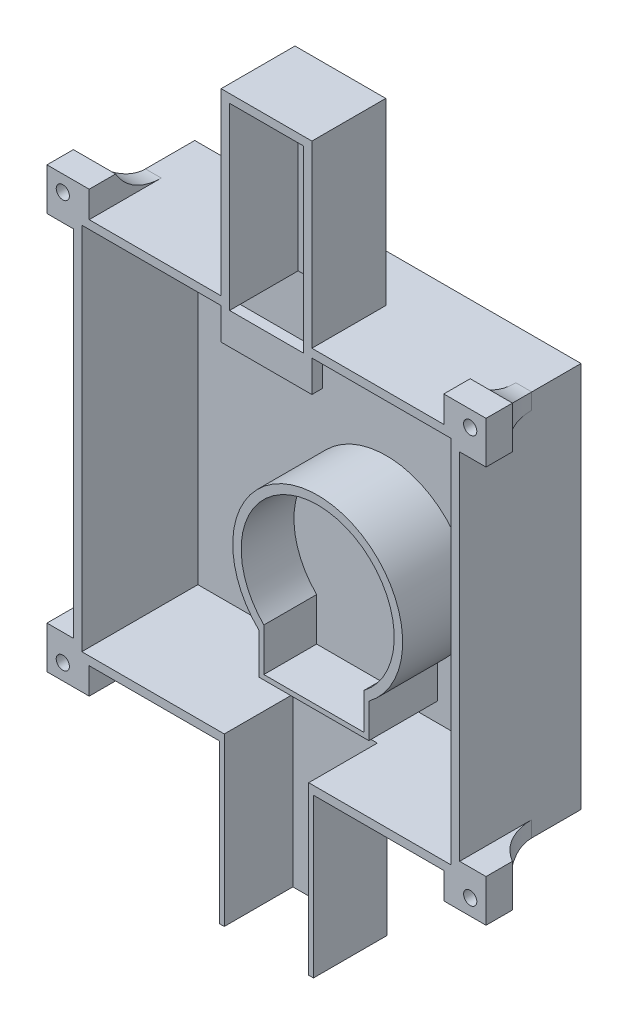
from build123d import *

# Parameters (mm, degrees)
BOSS_EXTRUDE2_DEPTH     = 23
BOSS_EXTRUDE2_2_DEPTH   = 23
BOSS_EXTRUDE2_3_DEPTH   = 23
BOSS_EXTRUDE2_4_DEPTH   = 23
SKETCH2_W               = 70
SKETCH2_H               = 1
BOSS_EXTRUDE3_DEPTH     = 70
SKETCH1_5_W             = 14
SKETCH1_5_H             = 1.6
BOSS_EXTRUDE4_DEPTH     = 10
BOSS_EXTRUDE5_DEPTH     = 5
SKETCH5_W               = 1.6
SKETCH5_H               = 35.6
BOSS_EXTRUDE6_DEPTH     = 1
SKETCH5_5_W             = 1.6
SKETCH5_5_H             = 35.6
BOSS_EXTRUDE7_DEPTH     = 14
SKETCH6_W               = 17.2
SKETCH6_H               = 1
BOSS_EXTRUDE8_DEPTH     = 34
SKETCH7_W               = 17.2
SKETCH7_H               = 1.6
BOSS_EXTRUDE9_DEPTH     = 13
BOSS_EXTRUDE10_DEPTH    = 10
BOSS_EXTRUDE11_DEPTH    = 30
SKETCH1_12_W            = 1.6
SKETCH1_12_H            = 10
BOSS_EXTRUDE18_DEPTH    = 23
BOSS_EXTRUDE14_DEPTH    = 3
BOSS_EXTRUDE15_DEPTH    = 13
SKETCH11_W              = 17.2
SKETCH11_H              = 2
BOSS_EXTRUDE16_DEPTH    = 6
ADVANCEDHOLE1_START     = 20
ADVANCEDHOLE1_OUTLINE_R = 1.25
ADVANCEDHOLE1_DEPTH     = 3
SKETCH1_11_W            = 1.6
SKETCH1_11_H            = 10
BOSS_EXTRUDE17_DEPTH    = 23
FILLET1_R               = 10


# Read off the part's stored shape, not the designer's step: AdvancedHole1
with BuildPart() as part:
    # Sketch1 → Boss-Extrude2 (new body)
    with BuildSketch(Plane.XY):
        Polygon((27, 0), (0, 0), (0, 30), (-1.6, 30), (-1.6, -1.6), (27, -1.6), align=None)
    extrude(amount=BOSS_EXTRUDE2_DEPTH)



with BuildPart() as body_2:
    # Sketch1 → Boss-Extrude2 2 (new body)
    with BuildSketch(Plane.XY):
        Polygon((-1.6, 40), (0, 40), (0, 70), (28, 70), (28, 71.6), (-1.6, 71.6), align=None)
    extrude(amount=BOSS_EXTRUDE2_2_DEPTH)


with BuildPart() as body_3:
    # Sketch1 → Boss-Extrude2 3 (new body)
    with BuildSketch(Plane.XY):
        Polygon((70, 0), (43, 0), (43, -1.6), (71.6, -1.6), (71.6, 30), (70, 30), align=None)
    extrude(amount=BOSS_EXTRUDE2_3_DEPTH)


with BuildPart() as body_4:
    # Sketch1 → Boss-Extrude2 4 (new body)
    with BuildSketch(Plane.XY):
        Polygon((42, 71.6), (42, 70), (70, 70), (70, 40), (71.6, 40), (71.6, 71.6), align=None)
    extrude(amount=BOSS_EXTRUDE2_4_DEPTH)


with BuildPart() as part_1:
    add(part.part)

    add(body_2.part)  # Boss-Extrude3 merges body 2

    add(body_3.part)  # Boss-Extrude3 merges body 3

    add(body_4.part)  # Boss-Extrude3 merges body 4
    # Sketch2 → Boss-Extrude3 (add)
    with BuildSketch(Plane(origin=(0, 0, 0), x_dir=(1, 0, 0), z_dir=(0, 1, 0))):
        with Locations((35, -0.5)):
            Rectangle(SKETCH2_W, SKETCH2_H)
    extrude(amount=BOSS_EXTRUDE3_DEPTH)

    # Sketch1<5> → Boss-Extrude4 (add)
    with BuildSketch(Plane.XY):
        with Locations((35, 70.8)):
            Rectangle(SKETCH1_5_W, SKETCH1_5_H)
    extrude(amount=BOSS_EXTRUDE4_DEPTH)

    # Sketch4 → Boss-Extrude5 (add)
    with BuildSketch(Plane.XY.offset(23)):
        Polygon((1.4, 71.6), (1.4, 74.604290744), (-4.6, 74.604290744), (-4.6, 68.6), (-1.6, 68.6), (-1.6, 71.6), align=None)
        Polygon((-4.6, 74.604290744), (1.4, 74.604290744), (1.4, 76.6), (-6.6, 76.6), (-6.6, 68.6), (-4.6, 68.6), align=None)
        Polygon((74.608581487, 74.604290744), (68.6, 74.604290744), (68.6, 71.6), (71.6, 71.6), (71.6, 68.6), (74.608581487, 68.6), align=None)
        Polygon((68.6, 76.6), (68.6, 74.604290744), (74.608581487, 74.604290744), (74.608581487, 68.6), (76.6, 68.6), (76.6, 76.6), align=None)
        Polygon((74.608581487, -4.604290744), (74.608581487, 1.4), (71.6, 1.4), (71.6, -1.6), (68.6, -1.6), (68.6, -4.604290744), align=None)
        Polygon((76.6, 1.4), (74.608581487, 1.4), (74.608581487, -4.604290744), (68.6, -4.604290744), (68.6, -6.6), (76.6, -6.6), align=None)
        Polygon((-1.6, 1.399584801), (-4.6, 1.399584801), (-4.6, -4.604290744), (1.4, -4.604290744), (1.4, -1.6), (-1.6, -1.6), align=None)
        Polygon((-4.6, -4.604290744), (-4.6, 1.399584801), (-6.6, 1.399584801), (-6.6, -6.600415199), (1.4, -6.600415199), (1.4, -4.604290744), align=None)
    extrude(amount=-BOSS_EXTRUDE5_DEPTH)

    # Sketch5 → Boss-Extrude6 (add)
    with BuildSketch(Plane.XY.offset(23)):
        with Locations((27.2, 87.8)):
            Rectangle(SKETCH5_W, SKETCH5_H)
        with Locations((42.8, 87.8)):
            Rectangle(SKETCH5_W, SKETCH5_H)
    extrude(amount=-BOSS_EXTRUDE6_DEPTH)

    # Sketch5<5> → Boss-Extrude7 (add)
    with BuildSketch(Plane.XY.offset(23)):
        with Locations((27.2, 87.8)):
            Rectangle(SKETCH5_5_W, SKETCH5_5_H)
        with Locations((42.8, 87.8)):
            Rectangle(SKETCH5_5_W, SKETCH5_5_H)
    extrude(amount=-BOSS_EXTRUDE7_DEPTH)

    # Sketch6 → Boss-Extrude8 (add)
    with BuildSketch(Plane(origin=(0, 71.6, 0), x_dir=(1, 0, 0), z_dir=(0, 1, 0))):
        with Locations((35, -9.5)):
            Rectangle(SKETCH6_W, SKETCH6_H)
    extrude(amount=BOSS_EXTRUDE8_DEPTH)

    # Sketch7 → Boss-Extrude9 (add)
    with BuildSketch(Plane.XY.offset(10)):
        with Locations((35, 104.8)):
            Rectangle(SKETCH7_W, SKETCH7_H)
    extrude(amount=BOSS_EXTRUDE9_DEPTH)

    # Sketch1<9> → Boss-Extrude10 (add)
    with BuildSketch(Plane.XY):
        Polygon((35.002057043, 0), (27, 0), (27, -1.6), (35.00134155, -1.6), align=None)
        Polygon((43, 0), (35.002057043, 0), (35.00134155, -1.6), (43, -1.6), align=None)
    extrude(amount=BOSS_EXTRUDE10_DEPTH)

    # Sketch8 → Boss-Extrude11 (add)
    with BuildSketch(Plane.XZ.offset(1.6)):
        Polygon((27, 23), (26.1, 23), (26.1, 9.1), (43.9, 9.1), (43.9, 23), (43, 23), (43, 10), (27, 10), align=None)
    extrude(amount=BOSS_EXTRUDE11_DEPTH)

    # Sketch1<12> → Boss-Extrude18 (add)
    with BuildSketch(Plane.XY):
        Polygon((-1.6, 30), (0, 30), (0, 40), (-0.266113958, 40), (-1.6, 40), align=None)
        with Locations((70.8, 35)):
            Rectangle(SKETCH1_12_W, SKETCH1_12_H)
    extrude(amount=BOSS_EXTRUDE18_DEPTH)

    # Sketch10 → Boss-Extrude14 (add)
    with BuildSketch(Plane.XY.offset(1)):
        with BuildLine():
            Line((24.6, 3.6), (45.4, 3.6))
            Line((45.4, 3.6), (45.4, 10.08837101))
            ThreePointArc((45.4, 10.08837101), (36.618060655, 39.01207741), (24.6, 11.276369944))
            Line((24.6, 11.276369944), (24.6, 3.6))
        make_face()
    extrude(amount=BOSS_EXTRUDE14_DEPTH)

    # Sketch10<5> → Boss-Extrude15 (add)
    with BuildSketch(Plane.XY.offset(1)):
        with BuildLine():
            Line((24.6, 11.276369944), (24.6, 3.6))
            Line((24.6, 3.6), (45.4, 3.6))
            Line((45.4, 3.6), (45.4, 10.08837101))
            ThreePointArc((45.4, 10.08837101), (36.618060655, 39.01207741), (24.6, 11.276369944))
        make_face()
        with BuildLine():
            Line((44.5, 4.5), (25.5, 4.5))
            Line((25.5, 4.5), (25.5, 12.632450137))
            ThreePointArc((25.5, 12.632450137), (36.628000353, 37.40854724), (44.5, 11.413951628))
            Line((44.5, 11.413951628), (44.5, 4.5))
        make_face(mode=Mode.SUBTRACT)
    extrude(amount=BOSS_EXTRUDE15_DEPTH)

    # Sketch11 → Boss-Extrude16 (add)
    with BuildSketch(Plane.XZ.offset(-70)):
        with Locations((35, 22)):
            Rectangle(SKETCH11_W, SKETCH11_H)
    extrude(amount=BOSS_EXTRUDE16_DEPTH)

    # AdvancedHole1 outline → AdvancedHole1 (cut)
    with BuildSketch(Plane.XY.offset(ADVANCEDHOLE1_START)):
        with Locations((-3.6, -3.600415199)):
            Circle(ADVANCEDHOLE1_OUTLINE_R)
        with Locations((73.6, -3.6)):
            Circle(ADVANCEDHOLE1_OUTLINE_R)
        with Locations((-3.6, 73.6)):
            Circle(ADVANCEDHOLE1_OUTLINE_R)
        with Locations((73.6, 73.6)):
            Circle(ADVANCEDHOLE1_OUTLINE_R)
    extrude(amount=ADVANCEDHOLE1_DEPTH, mode=Mode.SUBTRACT)

    # Sketch1<11> → Boss-Extrude17 (add)
    with BuildSketch(Plane.XY):
        Polygon((-1.6, 30), (0, 30), (0, 40), (-0.266113958, 40), (-1.6, 40), align=None)
        with Locations((70.8, 35)):
            Rectangle(SKETCH1_11_W, SKETCH1_11_H)
    extrude(amount=BOSS_EXTRUDE17_DEPTH)

    # Fillet1
    # the kernel refuses this fillet: 10 mm, written as the material it adds along each edge
    with BuildSketch(Plane(origin=(1.4, -1.6, 18), x_dir=(0, 0, -1), z_dir=(-1, 0, 0))) as fillet1_piece_1:
        with BuildLine():
            CenterArc((8.66049374, 10), FILLET1_R, 209.997253102, 60.002746898)
            Line((0, 5.000415199), (-0.173209875, 4.900423503))
            ThreePointArc((-0.173209875, 4.900423503), (-0.2, 2.5002076), (-0.2, 0))
            Line((-0.2, 0), (0, -0.2))
            Line((0, -0.2), (8.66049374, -0.2))
            Line((8.66049374, -0.2), (8.66049374, 0))
        make_face()
    extrude(amount=3)
    with BuildSketch(Plane(origin=(-1.6, -1.6, 18), x_dir=(0, 0, -1), z_dir=(0, 1, 0))) as fillet1_piece_2:
        with BuildLine():
            CenterArc((8.660254038, 10), FILLET1_R, 210, 60)
            Line((0, 5), (-0.173205081, 4.9))
            ThreePointArc((-0.173205081, 4.9), (-0.2, 2.5), (-0.2, 0))
            Line((-0.2, 0), (0, -0.2))
            Line((0, -0.2), (8.660254038, -0.2))
            Line((8.660254038, -0.2), (8.660254038, 0))
        make_face()
    extrude(amount=2.999584801)
    with BuildSketch(Plane(origin=(71.6, -1.6, 18), x_dir=(0, 0, -1), z_dir=(-1, 0, 0)), Plane(origin=(68.6, 71.6, 18), x_dir=(0, 0, -1), z_dir=(1, 0, 0)), Plane(origin=(-1.6, 68.6, 18), x_dir=(0, 0, -1), z_dir=(0, 1, 0))) as fillet1_piece_3:
        with BuildLine():
            CenterArc((8.660254038, 10), FILLET1_R, 210, 60)
            Line((0, 5), (-0.173205081, 4.9))
            ThreePointArc((-0.173205081, 4.9), (-0.2, 2.5), (-0.2, 0))
            Line((-0.2, 0), (0, -0.2))
            Line((0, -0.2), (8.660254038, -0.2))
            Line((8.660254038, -0.2), (8.660254038, 0))
        make_face()
    extrude(amount=3)
    with BuildSketch(Plane(origin=(71.6, 1.4, 18), x_dir=(1, 0, 0), z_dir=(0, -1, 0)), Plane(origin=(71.6, 71.6, 18), x_dir=(1, 0, 0), z_dir=(0, -1, 0)), Plane(origin=(-1.6, 71.6, 18), x_dir=(0, 1, 0), z_dir=(1, 0, 0))) as fillet1_piece_4:
        with BuildLine():
            CenterArc((10, -8.660254038), FILLET1_R, 120, 60)
            Line((0, -8.660254038), (-0.2, -8.660254038))
            Line((-0.2, -8.660254038), (-0.2, 0))
            Line((-0.2, 0), (0, 0.2))
            ThreePointArc((0, 0.2), (2.5, 0.2), (4.9, 0.173205081))
            Line((4.9, 0.173205081), (5, 0))
        make_face()
    extrude(amount=3)
    with BuildSketch(Plane(origin=(1.4, -1.6, 18), x_dir=(0, 0, -1), z_dir=(-1, 0, 0))) as fillet1_piece_5a_section:
        with BuildLine():
            CenterArc((8.66049374, 10), FILLET1_R, 209.997253102, 60.002746898)
            Line((0, 5.000415199), (-0.173209875, 4.900423503))
            ThreePointArc((-0.173209875, 4.900423503), (-0.2, 2.5002076), (-0.2, 0))
            Line((-0.2, 0), (0, -0.2))
            Line((0, -0.2), (8.66049374, -0.2))
            Line((8.66049374, -0.2), (8.66049374, 0))
        make_face()
    fillet1_piece_5a = extrude(amount=24.65123435, mode=Mode.PRIVATE)
    fillet1_piece_5a = split(fillet1_piece_5a, bisect_by=Plane(origin=(-1.6, -2.895276984, 15.83686011), z_dir=(-1, 0, 0)), keep=Keep.TOP, mode=Mode.PRIVATE)
    fillet1_piece_5a = split(fillet1_piece_5a, bisect_by=Plane(origin=(-6.6, -2.895276984, 15.83686011), z_dir=(1, 0, 0)), keep=Keep.TOP, mode=Mode.PRIVATE)
    with BuildSketch(Plane(origin=(-1.6, -23.250635095, 18), x_dir=(0, 0, -1), z_dir=(0, 1, 0))) as fillet1_piece_5b_section:
        with BuildLine():
            CenterArc((8.660254038, 10), FILLET1_R, 210, 60)
            Line((0, 5), (-0.173205081, 4.9))
            ThreePointArc((-0.173205081, 4.9), (-0.2, 2.5), (-0.2, 0))
            Line((-0.2, 0), (0, -0.2))
            Line((0, -0.2), (8.660254038, -0.2))
            Line((8.660254038, -0.2), (8.660254038, 0))
        make_face()
    fillet1_piece_5b = extrude(amount=24.650219895, mode=Mode.PRIVATE)
    fillet1_piece_5b = split(fillet1_piece_5b, bisect_by=Plane(origin=(-2.895167111, -1.6, 15.836895542), z_dir=(0, -1, 0)), keep=Keep.TOP, mode=Mode.PRIVATE)
    fillet1_piece_5b = split(fillet1_piece_5b, bisect_by=Plane(origin=(-2.895167111, -6.600415199, 15.836895542), z_dir=(0, 1, 0)), keep=Keep.TOP, mode=Mode.PRIVATE)
    fillet1_piece_5 = fillet1_piece_5a & fillet1_piece_5b
    add(fillet1_piece_5)
    with BuildSketch(Plane(origin=(93.250635095, -1.6, 18), x_dir=(0, 0, -1), z_dir=(-1, 0, 0))) as fillet1_piece_6a_section:
        with BuildLine():
            CenterArc((8.660254038, 10), FILLET1_R, 210, 60)
            Line((0, 5), (-0.173205081, 4.9))
            ThreePointArc((-0.173205081, 4.9), (-0.2, 2.5), (-0.2, 0))
            Line((-0.2, 0), (0, -0.2))
            Line((0, -0.2), (8.660254038, -0.2))
            Line((8.660254038, -0.2), (8.660254038, 0))
        make_face()
    fillet1_piece_6a = extrude(amount=24.650635095, mode=Mode.PRIVATE)
    fillet1_piece_6a = split(fillet1_piece_6a, bisect_by=Plane(origin=(71.6, -2.895167111, 15.836895542), z_dir=(1, 0, 0)), keep=Keep.TOP, mode=Mode.PRIVATE)
    fillet1_piece_6a = split(fillet1_piece_6a, bisect_by=Plane(origin=(76.6, -2.895167111, 15.836895542), z_dir=(-1, 0, 0)), keep=Keep.TOP, mode=Mode.PRIVATE)
    with BuildSketch(Plane(origin=(71.6, 1.4, 18), x_dir=(1, 0, 0), z_dir=(0, -1, 0))) as fillet1_piece_6b_section:
        with BuildLine():
            CenterArc((10, -8.660254038), FILLET1_R, 120, 60)
            Line((0, -8.660254038), (-0.2, -8.660254038))
            Line((-0.2, -8.660254038), (-0.2, 0))
            Line((-0.2, 0), (0, 0.2))
            ThreePointArc((0, 0.2), (2.5, 0.2), (4.9, 0.173205081))
            Line((4.9, 0.173205081), (5, 0))
        make_face()
    fillet1_piece_6b = extrude(amount=24.650635095, mode=Mode.PRIVATE)
    fillet1_piece_6b = split(fillet1_piece_6b, bisect_by=Plane(origin=(72.895167111, -1.6, 15.836895542), z_dir=(0, -1, 0)), keep=Keep.TOP, mode=Mode.PRIVATE)
    fillet1_piece_6b = split(fillet1_piece_6b, bisect_by=Plane(origin=(72.895167111, -6.6, 15.836895542), z_dir=(0, 1, 0)), keep=Keep.TOP, mode=Mode.PRIVATE)
    fillet1_piece_6 = fillet1_piece_6a & fillet1_piece_6b
    add(fillet1_piece_6)
    with BuildSketch(Plane(origin=(68.6, 71.6, 18), x_dir=(0, 0, -1), z_dir=(1, 0, 0))) as fillet1_piece_7a_section:
        with BuildLine():
            CenterArc((8.660254038, 10), FILLET1_R, 210, 60)
            Line((0, 5), (-0.173205081, 4.9))
            ThreePointArc((-0.173205081, 4.9), (-0.2, 2.5), (-0.2, 0))
            Line((-0.2, 0), (0, -0.2))
            Line((0, -0.2), (8.660254038, -0.2))
            Line((8.660254038, -0.2), (8.660254038, 0))
        make_face()
    fillet1_piece_7a = extrude(amount=24.650635095, mode=Mode.PRIVATE)
    fillet1_piece_7a = split(fillet1_piece_7a, bisect_by=Plane(origin=(71.6, 72.895167111, 15.836895542), z_dir=(1, 0, 0)), keep=Keep.TOP, mode=Mode.PRIVATE)
    fillet1_piece_7a = split(fillet1_piece_7a, bisect_by=Plane(origin=(76.6, 72.895167111, 15.836895542), z_dir=(-1, 0, 0)), keep=Keep.TOP, mode=Mode.PRIVATE)
    with BuildSketch(Plane(origin=(71.6, 93.250635095, 18), x_dir=(1, 0, 0), z_dir=(0, -1, 0))) as fillet1_piece_7b_section:
        with BuildLine():
            CenterArc((10, -8.660254038), FILLET1_R, 120, 60)
            Line((0, -8.660254038), (-0.2, -8.660254038))
            Line((-0.2, -8.660254038), (-0.2, 0))
            Line((-0.2, 0), (0, 0.2))
            ThreePointArc((0, 0.2), (2.5, 0.2), (4.9, 0.173205081))
            Line((4.9, 0.173205081), (5, 0))
        make_face()
    fillet1_piece_7b = extrude(amount=24.650635095, mode=Mode.PRIVATE)
    fillet1_piece_7b = split(fillet1_piece_7b, bisect_by=Plane(origin=(72.895167111, 71.6, 15.836895542), z_dir=(0, 1, 0)), keep=Keep.TOP, mode=Mode.PRIVATE)
    fillet1_piece_7b = split(fillet1_piece_7b, bisect_by=Plane(origin=(72.895167111, 76.6, 15.836895542), z_dir=(0, -1, 0)), keep=Keep.TOP, mode=Mode.PRIVATE)
    fillet1_piece_7 = fillet1_piece_7a & fillet1_piece_7b
    add(fillet1_piece_7)
    with BuildSketch(Plane(origin=(-1.6, 68.6, 18), x_dir=(0, 0, -1), z_dir=(0, 1, 0))) as fillet1_piece_8a_section:
        with BuildLine():
            CenterArc((8.660254038, 10), FILLET1_R, 210, 60)
            Line((0, 5), (-0.173205081, 4.9))
            ThreePointArc((-0.173205081, 4.9), (-0.2, 2.5), (-0.2, 0))
            Line((-0.2, 0), (0, -0.2))
            Line((0, -0.2), (8.660254038, -0.2))
            Line((8.660254038, -0.2), (8.660254038, 0))
        make_face()
    fillet1_piece_8a = extrude(amount=24.650635095, mode=Mode.PRIVATE)
    fillet1_piece_8a = split(fillet1_piece_8a, bisect_by=Plane(origin=(-2.895167111, 71.6, 15.836895542), z_dir=(0, 1, 0)), keep=Keep.TOP, mode=Mode.PRIVATE)
    fillet1_piece_8a = split(fillet1_piece_8a, bisect_by=Plane(origin=(-2.895167111, 76.6, 15.836895542), z_dir=(0, -1, 0)), keep=Keep.TOP, mode=Mode.PRIVATE)
    with BuildSketch(Plane(origin=(-23.250635095, 71.6, 18), x_dir=(0, 1, 0), z_dir=(1, 0, 0))) as fillet1_piece_8b_section:
        with BuildLine():
            CenterArc((10, -8.660254038), FILLET1_R, 120, 60)
            Line((0, -8.660254038), (-0.2, -8.660254038))
            Line((-0.2, -8.660254038), (-0.2, 0))
            Line((-0.2, 0), (0, 0.2))
            ThreePointArc((0, 0.2), (2.5, 0.2), (4.9, 0.173205081))
            Line((4.9, 0.173205081), (5, 0))
        make_face()
    fillet1_piece_8b = extrude(amount=24.650635095, mode=Mode.PRIVATE)
    fillet1_piece_8b = split(fillet1_piece_8b, bisect_by=Plane(origin=(-1.6, 72.895167111, 15.836895542), z_dir=(-1, 0, 0)), keep=Keep.TOP, mode=Mode.PRIVATE)
    fillet1_piece_8b = split(fillet1_piece_8b, bisect_by=Plane(origin=(-6.6, 72.895167111, 15.836895542), z_dir=(1, 0, 0)), keep=Keep.TOP, mode=Mode.PRIVATE)
    fillet1_piece_8 = fillet1_piece_8a & fillet1_piece_8b
    add(fillet1_piece_8)


solid = part_1.part
